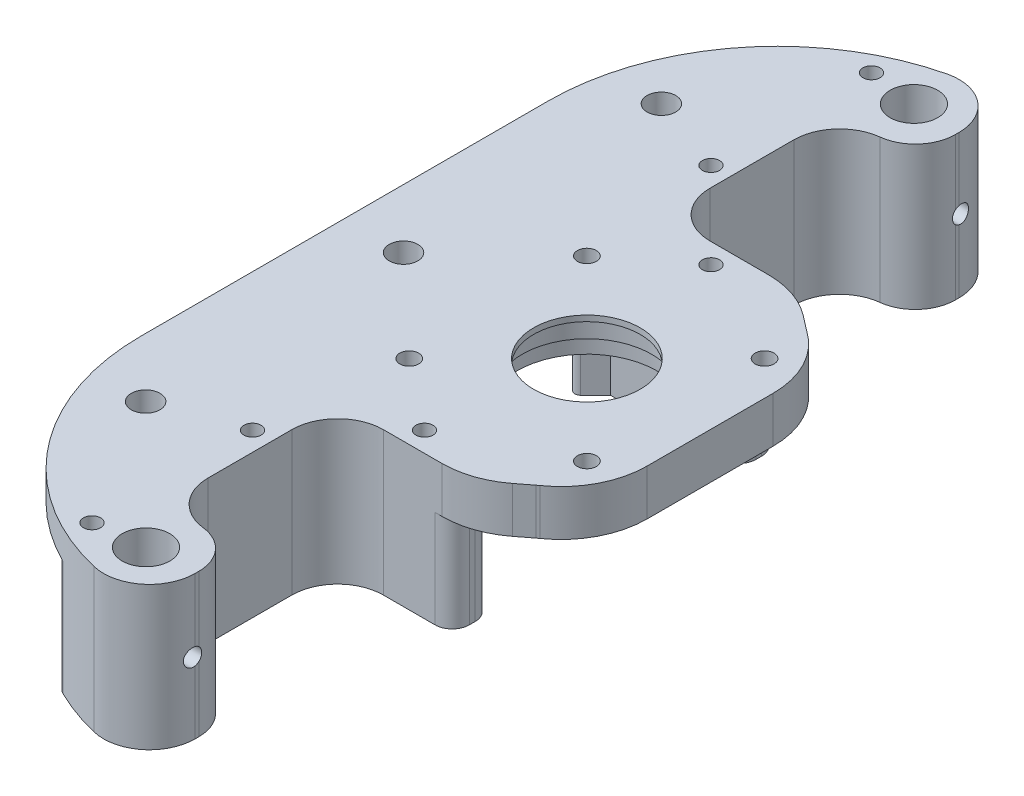
from build123d import *

# Parameters (mm, degrees)
SZKIC2_R                        = 1.65
SZKIC2_R_2                      = 11.3
SZKIC2_W                        = 13.3
SZKIC2_H                        = 7
SZKIC2_R_3                      = 1.5
SZKIC2_W_2                      = 6.7
SZKIC2_R_4                      = 4.15
SZKIC2_R_5                      = 2.5
DODANIE_WYCI_GNI_CIE1_DEPTH     = 5
DODANIE_WYCI_GNI_CIE2_START     = -20
SZKIC2_3_R                      = 1.5
DODANIE_WYCI_GNI_CIE2_DEPTH     = 20
ZAOKR_GLENIE1_R                 = 7
SZKIC3_R                        = 4.15
DODANIE_WYCI_GNI_CIE3_DEPTH     = 20
ZAOKR_GLENIE2_R                 = 3
ZAOKR_GLENIE3_R                 = 10
WYTNIJ_WYCI_GNI_CIE1_DEPTH      = 146.394986561
ZAOKR_GLENIE4_R                 = 15
ZAOKR_GLENIE5_R                 = 1
ZAOKR_GLENIE6_R                 = 40
ZAOKR_GLENIE7_R                 = 3
ZAOKR_GLENIE10_R                = 8
ZAOKR_GLENIE11_R                = 8
DODANIE_WYCI_GNI_CIE4_START     = -1
SZKIC6_R                        = 11.3
SZKIC6_R_2                      = 9.3
DODANIE_WYCI_GNI_CIE4_DEPTH     = 1
SZKIC7_R                        = 12.25
SZKIC7_R_2                      = 1.65
DODANIE_WYCI_GNI_CIE5_DEPTH     = 3
WYTNIJ_WYCI_GNI_CIE4_REACH      = 120.613
WYTNIJ_WYCI_GNI_CIE4_END_RADIUS = 4.15
SZKIC9_R                        = 1.5
WYTNIJ_WYCI_GNI_CIE5_REACH      = 120.613
WYTNIJ_WYCI_GNI_CIE5_END_RADIUS = 4.15
SZKIC9_3_R                      = 1.5


with BuildPart() as part:
    # Szkic2 → Dodanie-wyciągnięcie1 (new body)
    # profile 1 of 14: a face of its own
    with BuildSketch(Plane(origin=(0, 0, 0), x_dir=(1, 0, 0), z_dir=(0, 1, 0))):
        Polygon((-68.051313495, 13.491175162), (-65.66044053, 13.491175162), (-52.36044053, 13.491175162), (-45.66044053, 13.491175162), (-33.269567565, 13.491175162), (-29.16044053, 13.491175162), (-29.16044053, 17.600302197), (-29.16044053, 52.382048128), (-29.16044053, 56.491175162), (-33.269567565, 56.491175162), (-45.66044053, 56.491175162), (-52.36044053, 56.491175162), (-65.66044053, 56.491175162), (-68.051313495, 56.491175162), (-72.36044053, 52.182048128), (-72.36044053, 17.800302197), align=None)
        with Locations(Location((-66.16044053, 19.491175162, 0), (0, 0, 270))):
            Circle(SZKIC2_R, mode=Mode.SUBTRACT)
        with Locations(Location((-50.66044053, 34.991175162, 0), (0, 0, 270))):
            Circle(SZKIC2_R_2, mode=Mode.SUBTRACT)
        with Locations(Location((-35.16044053, 19.491175162, 0), (0, 0, 270))):
            Circle(SZKIC2_R, mode=Mode.SUBTRACT)
        with Locations(Location((-66.16044053, 50.491175162, 0), (0, 0, 270))):
            Circle(SZKIC2_R, mode=Mode.SUBTRACT)
        with Locations(Location((-35.16044053, 50.491175162, 0), (0, 0, 270))):
            Circle(SZKIC2_R, mode=Mode.SUBTRACT)
    # profile 2 of 14: a face of its own
    with BuildSketch(Plane(origin=(0, 0, 0), x_dir=(1, 0, 0), z_dir=(0, 1, 0))):
        with Locations((-59.01044053, 9.991175162)):
            Rectangle(SZKIC2_W, SZKIC2_H)
        with Locations(Location((-54.01044053, 9.991175162, 0), (0, 0, 270))):
            Circle(SZKIC2_R_3, mode=Mode.SUBTRACT)
    # profile 3 of 14: a face of its own
    with BuildSketch(Plane(origin=(0, 0, 0), x_dir=(1, 0, 0), z_dir=(0, 1, 0))):
        Polygon((-65.66044053, 6.491175162), (-65.66044053, 13.491175162), (-68.051313495, 13.491175162), (-72.36044053, 17.800302197), (-72.36044053, -11.508824838), (-72.36044053, -40.008824838), (-65.66044053, -40.008824838), (-65.66044053, -11.508824838), align=None)
        with Locations(Location((-69.01044053, -33.008824838, 0), (0, 0, 270))):
            Circle(SZKIC2_R_3, mode=Mode.SUBTRACT)
        with Locations(Location((-69.01044053, -5.008824838, 0), (0, 0, 270))):
            Circle(SZKIC2_R_3, mode=Mode.SUBTRACT)
    # profile 4 of 14: a face of its own
    with BuildSketch(Plane(origin=(0, 0, 0), x_dir=(1, 0, 0), z_dir=(0, 1, 0))):
        with Locations((-49.01044053, 9.991175162)):
            Rectangle(SZKIC2_W_2, SZKIC2_H)
    # profile 5 of 14: a face of its own
    with BuildSketch(Plane(origin=(0, 0, 0), x_dir=(1, 0, 0), z_dir=(0, 1, 0))):
        Polygon((-52.36044053, 6.491175162), (-65.66044053, 6.491175162), (-65.66044053, -11.508824838), (-52.36044053, -1.243587456), align=None)
    # profile 6 of 14: a face of its own
    with BuildSketch(Plane(origin=(0, 0, 0), x_dir=(1, 0, 0), z_dir=(0, 1, 0))):
        Polygon((-33.269567565, 13.491175162), (-45.66044053, 13.491175162), (-45.66044053, 6.491175162), (-52.36044053, 6.491175162), (-52.36044053, -1.243587456), align=None)
    # profile 7 of 14: a face of its own
    with BuildSketch(Plane(origin=(0, 0, 0), x_dir=(1, 0, 0), z_dir=(0, 1, 0))):
        Polygon((-52.36044053, -1.243587456), (-65.66044053, -11.508824838), (-65.66044053, -40.008824838), (-52.36044053, -40.008824838), align=None)
        with Locations(Location((-60.594472333, -32.008824838, 0), (0, 0, 270))):
            Circle(SZKIC2_R_4, mode=Mode.SUBTRACT)
    # profile 8 of 14: a face of its own
    with BuildSketch(Plane(origin=(0, 0, 0), x_dir=(1, 0, 0), z_dir=(0, 1, 0))):
        Polygon((-72.36044053, -11.508824838), (-72.36044053, 17.800302197), (-72.36044053, 52.182048128), (-72.36044053, 81.491175162), (-72.36044053, 109.991175162), (-92.96044053, 109.991175162), (-92.96044053, 81.491175162), (-92.96044053, -11.508824838), (-92.96044053, -40.008824838), (-72.36044053, -40.008824838), align=None)
        with Locations(Location((-82.66044053, -10.008824838, 0), (0, 0, 270))):
            Circle(SZKIC2_R_5, mode=Mode.SUBTRACT)
        with Locations(Location((-82.66044053, 34.991175162, 0), (0, 0, 270))):
            Circle(SZKIC2_R_5, mode=Mode.SUBTRACT)
        with Locations(Location((-82.66044053, 79.991175162, 0), (0, 0, 270))):
            Circle(SZKIC2_R_5, mode=Mode.SUBTRACT)
    # profile 9 of 14: a face of its own
    with BuildSketch(Plane(origin=(0, 0, 0), x_dir=(1, 0, 0), z_dir=(0, 1, 0))):
        Polygon((-72.36044053, 81.491175162), (-72.36044053, 52.182048128), (-68.051313495, 56.491175162), (-65.66044053, 56.491175162), (-65.66044053, 63.491175162), (-65.66044053, 81.491175162), (-65.66044053, 109.991175162), (-72.36044053, 109.991175162), align=None)
        with Locations(Location((-69.01044053, 74.991175162, 0), (0, 0, 270))):
            Circle(SZKIC2_R_3, mode=Mode.SUBTRACT)
        with Locations(Location((-69.01044053, 102.991175162, 0), (0, 0, 270))):
            Circle(SZKIC2_R_3, mode=Mode.SUBTRACT)
    # profile 10 of 14: a face of its own
    with BuildSketch(Plane(origin=(0, 0, 0), x_dir=(1, 0, 0), z_dir=(0, 1, 0))):
        with Locations((-59.01044053, 59.991175162)):
            Rectangle(SZKIC2_W, SZKIC2_H)
        with Locations(Location((-54.01044053, 59.991175162, 0), (0, 0, 270))):
            Circle(SZKIC2_R_3, mode=Mode.SUBTRACT)
    # profile 11 of 14: a face of its own
    with BuildSketch(Plane(origin=(0, 0, 0), x_dir=(1, 0, 0), z_dir=(0, 1, 0))):
        with Locations((-49.01044053, 59.991175162)):
            Rectangle(SZKIC2_W_2, SZKIC2_H)
    # profile 12 of 14: a face of its own
    with BuildSketch(Plane(origin=(0, 0, 0), x_dir=(1, 0, 0), z_dir=(0, 1, 0))):
        Polygon((-65.66044053, 81.491175162), (-65.66044053, 63.491175162), (-52.36044053, 63.491175162), (-52.36044053, 71.22593778), align=None)
    # profile 13 of 14: a face of its own
    with BuildSketch(Plane(origin=(0, 0, 0), x_dir=(1, 0, 0), z_dir=(0, 1, 0))):
        Polygon((-52.36044053, 109.991175162), (-65.66044053, 109.991175162), (-65.66044053, 81.491175162), (-52.36044053, 71.22593778), align=None)
        with Locations(Location((-60.594472333, 101.991175162, 0), (0, 0, 270))):
            Circle(SZKIC2_R_4, mode=Mode.SUBTRACT)
    # profile 14 of 14: a face of its own
    with BuildSketch(Plane(origin=(0, 0, 0), x_dir=(1, 0, 0), z_dir=(0, 1, 0))):
        Polygon((-45.66044053, 63.491175162), (-45.66044053, 56.491175162), (-33.269567565, 56.491175162), (-52.36044053, 71.22593778), (-52.36044053, 63.491175162), align=None)
    extrude(amount=DODANIE_WYCI_GNI_CIE1_DEPTH)

    # Szkic2<3> → Dodanie-wyciągnięcie2 (add)
    # profile 1 of 2: a face of its own
    with BuildSketch(Plane(origin=(0, 0, 0), x_dir=(1, 0, 0), z_dir=(0, 1, 0)).offset(DODANIE_WYCI_GNI_CIE2_START)):
        Polygon((-68.051313495, 13.491175162), (-72.36044053, 17.800302197), (-72.36044053, -40.008824838), (-65.66044053, -40.008824838), (-65.66044053, 6.491175162), (-45.66044053, 6.491175162), (-45.66044053, 13.491175162), align=None)
        with Locations(Location((-54.01044053, 9.991175162, 0), (0, 0, 270))):
            Circle(SZKIC2_3_R, mode=Mode.SUBTRACT)
        with Locations(Location((-69.01044053, -5.008824838, 0), (0, 0, 270))):
            Circle(SZKIC2_3_R, mode=Mode.SUBTRACT)
        with Locations(Location((-69.01044053, -33.008824838, 0), (0, 0, 270))):
            Circle(SZKIC2_3_R, mode=Mode.SUBTRACT)
    # profile 2 of 2: a face of its own
    with BuildSketch(Plane(origin=(0, 0, 0), x_dir=(1, 0, 0), z_dir=(0, 1, 0)).offset(DODANIE_WYCI_GNI_CIE2_START)):
        Polygon((-72.36044053, 109.991175162), (-72.36044053, 52.182048128), (-68.051313495, 56.491175162), (-45.66044053, 56.491175162), (-45.66044053, 63.491175162), (-65.66044053, 63.491175162), (-65.66044053, 109.991175162), align=None)
        with Locations(Location((-69.01044053, 74.991175162, 0), (0, 0, 270))):
            Circle(SZKIC2_3_R, mode=Mode.SUBTRACT)
        with Locations(Location((-69.01044053, 102.991175162, 0), (0, 0, 270))):
            Circle(SZKIC2_3_R, mode=Mode.SUBTRACT)
        with Locations(Location((-54.01044053, 59.991175162, 0), (0, 0, 270))):
            Circle(SZKIC2_3_R, mode=Mode.SUBTRACT)
    extrude(amount=DODANIE_WYCI_GNI_CIE2_DEPTH)

    # Zaokrąglenie1
    zaokr_glenie1_edges = [part.edges().sort_by_distance(p)[0] for p in [
        (-52.36044053, 2.5, 40.008824838),
        (-52.36044053, 2.5, -109.991175162),
    ]]
    fillet(zaokr_glenie1_edges, radius=ZAOKR_GLENIE1_R)

    # Szkic3 → Dodanie-wyciągnięcie3 (add)
    # profile 1 of 2: a face of its own
    with BuildSketch(Plane.XZ):
        with BuildLine():
            Line((-65.66044053, -109.991175162), (-59.36044053, -109.991175162))
            ThreePointArc((-59.36044053, -109.991175162), (-54.410693062, -107.940922631), (-52.36044053, -102.991175162))
            Line((-52.36044053, -102.991175162), (-52.36044053, -100.991175162))
            ThreePointArc((-52.36044053, -100.991175162), (-54.410693062, -96.041427694), (-59.36044053, -93.991175162))
            Line((-59.36044053, -93.991175162), (-65.66044053, -93.991175162))
            Line((-65.66044053, -93.991175162), (-65.66044053, -109.991175162))
        make_face()
        with Locations(Location((-60.594472333, -101.991175162, 0), (0, 0, 90))):
            Circle(SZKIC3_R, mode=Mode.SUBTRACT)
    # profile 2 of 2: a face of its own
    with BuildSketch(Plane.XZ):
        with BuildLine():
            Line((-65.66044053, 40.008824838), (-59.36044053, 40.008824838))
            ThreePointArc((-59.36044053, 40.008824838), (-54.410693062, 37.958572306), (-52.36044053, 33.008824838))
            Line((-52.36044053, 33.008824838), (-52.36044053, 31.008824838))
            ThreePointArc((-52.36044053, 31.008824838), (-54.410693062, 26.059077369), (-59.36044053, 24.008824838))
            Line((-59.36044053, 24.008824838), (-65.66044053, 24.008824838))
            Line((-65.66044053, 24.008824838), (-65.66044053, 40.008824838))
        make_face()
        with Locations(Location((-60.594472333, 32.008824838, 0), (0, 0, 90))):
            Circle(SZKIC3_R, mode=Mode.SUBTRACT)
    extrude(amount=DODANIE_WYCI_GNI_CIE3_DEPTH)

    # Zaokrąglenie2
    zaokr_glenie2_edges = [part.edges().sort_by_distance(p)[0] for p in [
        (-45.66044053, -10, -63.491175162),
        (-45.66044053, -10, -56.491175162),
        (-45.66044053, -10, -13.491175162),
        (-45.66044053, -10, -6.491175162),
    ]]
    fillet(zaokr_glenie2_edges, radius=ZAOKR_GLENIE2_R)

    # Zaokrąglenie3
    zaokr_glenie3_edges = [part.edges().sort_by_distance(p)[0] for p in [
        (-33.269567565, 2.5, -56.491175162),
        (-33.269567565, 2.5, -13.491175162),
    ]]
    fillet(zaokr_glenie3_edges, radius=ZAOKR_GLENIE3_R)

    # Szkic4 → Wytnij-wyciągnięcie1 (cut, through all)
    with BuildSketch(Plane.XZ):
        with BuildLine():
            Line((-52.36044053, 31.008824838), (-52.36044053, 1.243587456))
            Line((-52.36044053, 1.243587456), (-42.339011995, -6.491175162))
            Line((-42.339011995, -6.491175162), (-48.66044053, -6.491175162))
            Line((-48.66044053, -6.491175162), (-65.66044053, -6.491175162))
            Line((-65.66044053, -6.491175162), (-65.66044053, 24.008824838))
            Line((-65.66044053, 24.008824838), (-59.36044053, 24.008824838))
            ThreePointArc((-59.36044053, 24.008824838), (-54.410693062, 26.059077369), (-52.36044053, 31.008824838))
        make_face()
        with BuildLine():
            Line((-52.36044053, -71.22593778), (-52.36044053, -100.991175162))
            ThreePointArc((-52.36044053, -100.991175162), (-54.410693062, -96.041427694), (-59.36044053, -93.991175162))
            Line((-59.36044053, -93.991175162), (-65.66044053, -93.991175162))
            Line((-65.66044053, -93.991175162), (-65.66044053, -63.491175162))
            Line((-65.66044053, -63.491175162), (-48.66044053, -63.491175162))
            Line((-48.66044053, -63.491175162), (-42.339011995, -63.491175162))
            Line((-42.339011995, -63.491175162), (-52.36044053, -71.22593778))
        make_face()
    extrude(amount=-WYTNIJ_WYCI_GNI_CIE1_DEPTH, mode=Mode.SUBTRACT)

    # Zaokrąglenie4
    zaokr_glenie4_edges = [part.edges().sort_by_distance(p)[0] for p in [
        (-29.16044053, 2.5, -56.491175162),
        (-29.16044053, 2.5, -13.491175162),
        (-42.339011995, 2.5, -63.491175162),
        (-42.339011995, 2.5, -6.491175162),
    ]]
    fillet(zaokr_glenie4_edges, radius=ZAOKR_GLENIE4_R)

    # Zaokrąglenie5
    zaokr_glenie5_edges = [part.edges().sort_by_distance(p)[0] for p in [
        (-72.36044053, -10, -52.182048128),
        (-72.36044053, -10, -17.800302197),
    ]]
    fillet(zaokr_glenie5_edges, radius=ZAOKR_GLENIE5_R)

    # Zaokrąglenie6
    # the kernel refuses this fillet: 40 mm, written as the material it takes off along each edge
    with BuildSketch(Plane(origin=(-92.96044053, -98.711701434, -109.991175162), x_dir=(0, 0, 1), z_dir=(0, 1, 0))) as zaokr_glenie6_piece_1:
        with BuildLine():
            CenterArc((39.484680574, 40), ZAOKR_GLENIE6_R, 189.206896221, 80.793103779)
            Line((0, 33.6), (0, 0))
            Line((0, 0), (39.484680574, 0))
        make_face()
    extrude(amount=202.423402868, mode=Mode.SUBTRACT)
    with BuildSketch(Plane(origin=(-92.96044053, -98.711701434, 40.008824838), x_dir=(1, 0, 0), z_dir=(0, 1, 0))) as zaokr_glenie6_piece_2:
        with BuildLine():
            CenterArc((40, 39.484680574), ZAOKR_GLENIE6_R, 180, 80.793103779)
            Line((0, 39.484680574), (0, 0))
            Line((0, 0), (33.6, 0))
        make_face()
    extrude(amount=202.423402868, mode=Mode.SUBTRACT)

    # Zaokrąglenie7
    zaokr_glenie7_edges = [part.edges().sort_by_distance(p)[0] for p in [
        (-72.36044053, -10, -105.487060622),
        (-72.36044053, -10, 35.504710297),
    ]]
    fillet(zaokr_glenie7_edges, radius=ZAOKR_GLENIE7_R)

    # Zaokrąglenie10
    zaokr_glenie10_edges = [part.edges().sort_by_distance(p)[0] for p in [
        (-59.36044053, -7.5, -109.991175162),
        (-59.36044053, -7.5, 40.008824838),
    ]]
    fillet(zaokr_glenie10_edges, radius=ZAOKR_GLENIE10_R)

    # Zaokrąglenie11
    zaokr_glenie11_edges = [part.edges().sort_by_distance(p)[0] for p in [
        (-65.66044053, -7.5, 24.008824838),
        (-65.66044053, -7.5, -93.991175162),
        (-65.66044053, -7.5, -63.491175162),
        (-65.66044053, -7.5, -6.491175162),
    ]]
    fillet(zaokr_glenie11_edges, radius=ZAOKR_GLENIE11_R)

    # Szkic6 → Dodanie-wyciągnięcie4 (add)
    with BuildSketch(Plane(origin=(0, 5, 0), x_dir=(1, 0, 0), z_dir=(0, 1, 0)).offset(DODANIE_WYCI_GNI_CIE4_START)):
        with Locations(Location((-50.66044053, 34.991175162, 0), (0, 0, 270))):
            Circle(SZKIC6_R)
        with Locations(Location((-50.66044053, 34.991175162, 0), (0, 0, 270))):
            Circle(SZKIC6_R_2, mode=Mode.SUBTRACT)
    extrude(amount=DODANIE_WYCI_GNI_CIE4_DEPTH)

    # Szkic7 → Dodanie-wyciągnięcie5 (add)
    with BuildSketch(Plane.XZ):
        with BuildLine():
            Line((-72.36044053, -15.386088635), (-72.36044053, -54.59626169))
            ThreePointArc((-72.36044053, -54.59626169), (-71.743123963, -53.672382157), (-70.653333749, -53.889154909))
            Line((-70.653333749, -53.889154909), (-68.051313495, -56.491175162))
            Line((-68.051313495, -56.491175162), (-48.66044053, -56.491175162))
            ThreePointArc((-48.66044053, -56.491175162), (-46.539120187, -57.369854819), (-45.66044053, -59.491175162))
            Line((-45.66044053, -59.491175162), (-45.66044053, -60.491175162))
            ThreePointArc((-45.66044053, -60.491175162), (-46.539120187, -62.612495506), (-48.66044053, -63.491175162))
            Line((-48.66044053, -63.491175162), (-47.454451852, -63.491175162))
            ThreePointArc((-47.454451852, -63.491175162), (-42.612813728, -62.688306572), (-38.289468826, -60.365647199))
            Line((-38.289468826, -60.365647199), (-35.969263011, -58.574860471))
            ThreePointArc((-35.969263011, -58.574860471), (-35.776228908, -58.429559413), (-35.579740808, -58.288964287))
            ThreePointArc((-35.579740808, -58.288964287), (-30.861747064, -52.924289923), (-29.16044053, -45.985647975))
            Line((-29.16044053, -45.985647975), (-29.16044053, -23.99670235))
            ThreePointArc((-29.16044053, -23.99670235), (-30.861747064, -17.058060401), (-35.579740808, -11.693386037))
            ThreePointArc((-35.579740808, -11.693386037), (-35.776228908, -11.552790912), (-35.969263011, -11.407489853))
            Line((-35.969263011, -11.407489853), (-38.289468826, -9.616703126))
            ThreePointArc((-38.289468826, -9.616703126), (-42.612813728, -7.294043752), (-47.454451852, -6.491175162))
            Line((-47.454451852, -6.491175162), (-48.66044053, -6.491175162))
            ThreePointArc((-48.66044053, -6.491175162), (-46.539120187, -7.369854819), (-45.66044053, -9.491175162))
            Line((-45.66044053, -9.491175162), (-45.66044053, -10.491175162))
            ThreePointArc((-45.66044053, -10.491175162), (-46.539120187, -12.612495506), (-48.66044053, -13.491175162))
            Line((-48.66044053, -13.491175162), (-68.051313495, -13.491175162))
            Line((-68.051313495, -13.491175162), (-70.653333749, -16.093195416))
            ThreePointArc((-70.653333749, -16.093195416), (-71.743123963, -16.309968167), (-72.36044053, -15.386088635))
        make_face()
        with Locations(Location((-50.66044053, -34.991175162, 0), (0, 0, 270))):
            Circle(SZKIC7_R, mode=Mode.SUBTRACT)
        with Locations(Location((-66.16044053, -19.491175162, 0), (0, 0, 270))):
            Circle(SZKIC7_R_2, mode=Mode.SUBTRACT)
        with Locations(Location((-66.16044053, -50.491175162, 0), (0, 0, 270))):
            Circle(SZKIC7_R_2, mode=Mode.SUBTRACT)
        with Locations(Location((-35.16044053, -50.491175162, 0), (0, 0, 270))):
            Circle(SZKIC7_R_2, mode=Mode.SUBTRACT)
        with Locations(Location((-35.16044053, -19.491175162, 0), (0, 0, 270))):
            Circle(SZKIC7_R_2, mode=Mode.SUBTRACT)
    extrude(amount=DODANIE_WYCI_GNI_CIE5_DEPTH)

    # Wytnij-wyciągnięcie4: up to this cylinder (the profile starts outside it)
    wytnij_wyci_gni_cie4_end = Plane(origin=(-60.594472333, -7.5, 32.008824838), z_dir=(0, -1, 0)) * Cylinder(WYTNIJ_WYCI_GNI_CIE4_END_RADIUS, 250.526, mode=Mode.PRIVATE)
    # Szkic9 → Wytnij-wyciągnięcie4 (cut, up to the surface)
    with BuildSketch(Plane(origin=(-52.36044053, 0, 0), x_dir=(0, 0, -1), z_dir=(1, 0, 0)), mode=Mode.PRIVATE) as wytnij_wyci_gni_cie4_sk1:
        with Locations((-32.008824838, -7.5)):
            Circle(SZKIC9_R)
    wytnij_wyci_gni_cie4_tool1 = extrude(wytnij_wyci_gni_cie4_sk1.sketch, amount=-WYTNIJ_WYCI_GNI_CIE4_REACH, mode=Mode.PRIVATE) - wytnij_wyci_gni_cie4_end
    add(wytnij_wyci_gni_cie4_tool1.solids().sort_by_distance((-52.360441, -7.5, 32.008825))[0], mode=Mode.SUBTRACT)

    # Wytnij-wyciągnięcie5: up to this cylinder (the profile starts outside it)
    wytnij_wyci_gni_cie5_end = Plane(origin=(-60.594472333, -7.5, -101.991175162), z_dir=(0, -1, 0)) * Cylinder(WYTNIJ_WYCI_GNI_CIE5_END_RADIUS, 250.526, mode=Mode.PRIVATE)
    # Szkic9<3> → Wytnij-wyciągnięcie5 (cut, up to the surface)
    with BuildSketch(Plane(origin=(-52.36044053, 0, 0), x_dir=(0, 0, -1), z_dir=(1, 0, 0)), mode=Mode.PRIVATE) as wytnij_wyci_gni_cie5_sk1:
        with Locations((101.991175162, -7.5)):
            Circle(SZKIC9_3_R)
    wytnij_wyci_gni_cie5_tool1 = extrude(wytnij_wyci_gni_cie5_sk1.sketch, amount=-WYTNIJ_WYCI_GNI_CIE5_REACH, mode=Mode.PRIVATE) - wytnij_wyci_gni_cie5_end
    add(wytnij_wyci_gni_cie5_tool1.solids().sort_by_distance((-52.360441, -7.5, -101.991175))[0], mode=Mode.SUBTRACT)


solid = part.part
